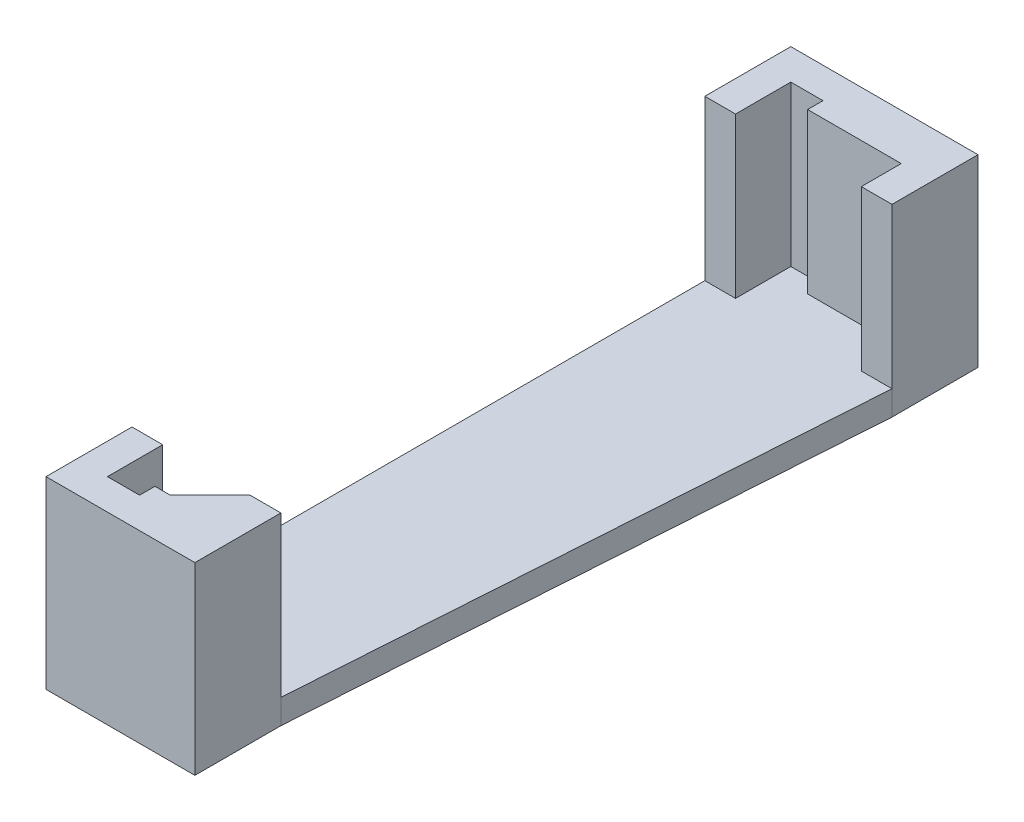
from build123d import *

# Parameters (mm, degrees)
SKETCH1_W           = 38.699948
SKETCH1_H           = 153.9875
BOSS_EXTRUDE1_DEPTH = 5.08
BOSS_EXTRUDE2_DEPTH = 33.02
CUT_EXTRUDE1_DEPTH  = 163.173242418


with BuildPart() as part:
    # Sketch1 → Boss-Extrude1 (new body)
    with BuildSketch(Plane(origin=(0, 0, 0), x_dir=(1, 0, 0), z_dir=(0, 1, 0))):
        with Locations((19.349974, 76.99375)):
            Rectangle(SKETCH1_W, SKETCH1_H)
    extrude(amount=BOSS_EXTRUDE1_DEPTH)

    # Sketch3 → Boss-Extrude2 (add)
    with BuildSketch(Plane(origin=(0, 5.08, 0), x_dir=(1, 0, 0), z_dir=(0, 1, 0))):
        Polygon((6.35, 147.6375), (13, 147.6375), (13, 144.4625), (32.35, 144.4625), (32.35, 136.2075), (38.7, 136.2075), (38.7, 153.9875), (0, 153.9875), (0, 136.2075), (6.35, 136.2075), align=None)
        Polygon((16.175, 9.525), (13, 9.525), (13, 6.35), (6.35, 6.35), (6.35, 17.78), (0, 17.78), (0, 0), (30.78, 0), (30.78, 17.78), (24.43, 17.78), align=None)
    extrude(amount=BOSS_EXTRUDE2_DEPTH)

    # Sketch4 → Cut-Extrude1 (cut, through all)
    with BuildSketch(Plane(origin=(0, 5.08, 0), x_dir=(1, 0, 0), z_dir=(0, 1, 0))):
        Polygon((30.78, 0), (38.699948, 0), (38.699948, 136.2075), (30.78, 17.78), align=None)
    extrude(amount=-CUT_EXTRUDE1_DEPTH, mode=Mode.SUBTRACT)


solid = part.part
